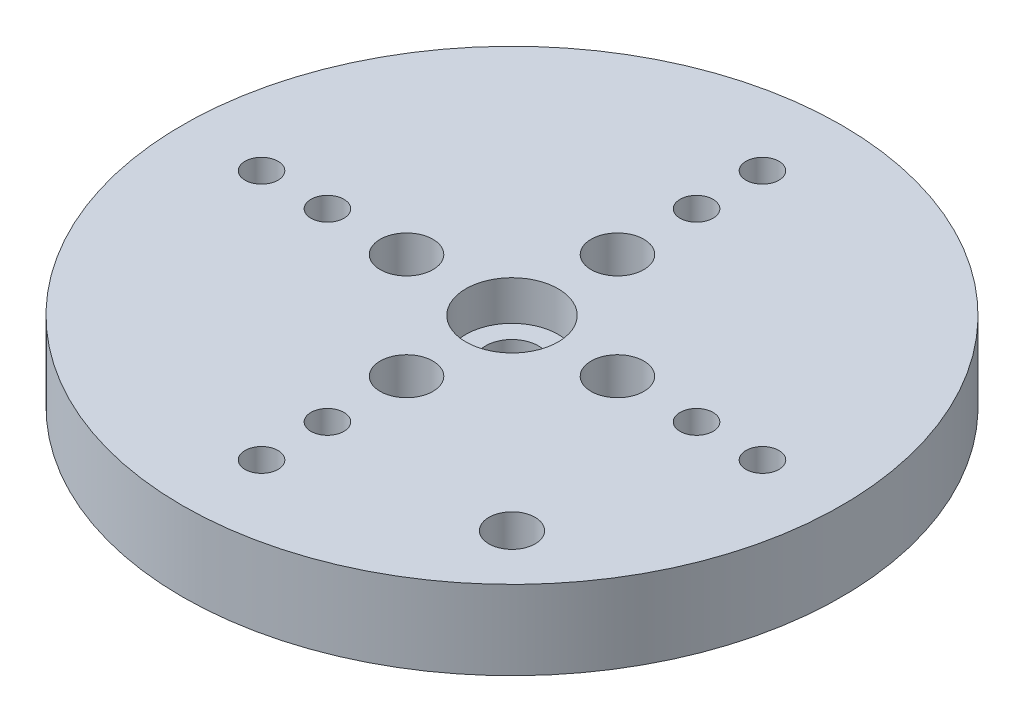
from build123d import *

# Parameters (mm, degrees)
SKETCH1_R           = 25
BOSS_EXTRUDE1_DEPTH = 6
CUT_EXTRUDE1_REACH  = 37.861
SKETCH2_R           = 2
SKETCH2_R_2         = 1.25
CIRPATTERN1_COUNT   = 4
CUT_EXTRUDE2_REACH  = 37.861
SKETCH3_R           = 2
SKETCH3_R_2         = 1.75
SKETCH4_R           = 3.5
CUT_EXTRUDE3_DEPTH  = 3


with BuildPart() as part:
    # Sketch1 → Boss-Extrude1 (new body)
    with BuildSketch(Plane(origin=(0, 0, 0), x_dir=(1, 0, 0), z_dir=(0, 1, 0))):
        Circle(SKETCH1_R)
    extrude(amount=BOSS_EXTRUDE1_DEPTH)

    # Sketch2 → Cut-Extrude1 (cut, up to next)
    with BuildSketch(Plane(origin=(0, 6, 0), x_dir=(1, 0, 0), z_dir=(0, 1, 0)), mode=Mode.PRIVATE) as cut_extrude1_sk1:
        with Locations((0, -8)):
            Circle(SKETCH2_R)
    cut_extrude1_tool1 = extrude(cut_extrude1_sk1.sketch, amount=-CUT_EXTRUDE1_REACH, mode=Mode.PRIVATE) & part.part
    # Sketch2 → Cut-Extrude1 (cut, up to next)
    with BuildSketch(Plane(origin=(0, 6, 0), x_dir=(1, 0, 0), z_dir=(0, 1, 0)), mode=Mode.PRIVATE) as cut_extrude1_sk2:
        with Locations((0, -14)):
            Circle(SKETCH2_R_2)
    cut_extrude1_tool2 = extrude(cut_extrude1_sk2.sketch, amount=-CUT_EXTRUDE1_REACH, mode=Mode.PRIVATE) & part.part
    # Sketch2 → Cut-Extrude1 (cut, up to next)
    with BuildSketch(Plane(origin=(0, 6, 0), x_dir=(1, 0, 0), z_dir=(0, 1, 0)), mode=Mode.PRIVATE) as cut_extrude1_sk3:
        with Locations((0, -19)):
            Circle(SKETCH2_R_2)
    cut_extrude1_tool3 = extrude(cut_extrude1_sk3.sketch, amount=-CUT_EXTRUDE1_REACH, mode=Mode.PRIVATE) & part.part
    cut_extrude1_1 = cut_extrude1_tool1.solids().sort_by_distance((0, 6, 8))[0]
    add(cut_extrude1_1, mode=Mode.SUBTRACT)
    cut_extrude1_2 = cut_extrude1_tool2.solids().sort_by_distance((0, 6, 14))[0]
    add(cut_extrude1_2, mode=Mode.SUBTRACT)
    cut_extrude1_3 = cut_extrude1_tool3.solids().sort_by_distance((0, 6, 19))[0]
    add(cut_extrude1_3, mode=Mode.SUBTRACT)
    cut_extrude1 = cut_extrude1_1 + cut_extrude1_2 + cut_extrude1_3  # Cut-Extrude1 as one shape, for the pattern or mirror that repeats it

    # CirPattern1: Cut-Extrude1 ×4 about axis
    cirpattern1_axis = Axis((0, 6, 0), (0, -1, 0))
    for i in range(1, CIRPATTERN1_COUNT):
        add(cut_extrude1.rotate(cirpattern1_axis, i * 360 / CIRPATTERN1_COUNT), mode=Mode.SUBTRACT)

    # Sketch3 → Cut-Extrude2 (cut, up to next)
    with BuildSketch(Plane(origin=(0, 6, 0), x_dir=(1, 0, 0), z_dir=(0, 1, 0)), mode=Mode.PRIVATE) as cut_extrude2_sk1:
        Circle(SKETCH3_R)
    cut_extrude2_tool1 = extrude(cut_extrude2_sk1.sketch, amount=-CUT_EXTRUDE2_REACH, mode=Mode.PRIVATE) & part.part
    # Sketch3 → Cut-Extrude2 (cut, up to next)
    with BuildSketch(Plane(origin=(0, 6, 0), x_dir=(1, 0, 0), z_dir=(0, 1, 0)), mode=Mode.PRIVATE) as cut_extrude2_sk2:
        with Locations((14.142135624, -14.142135624)):
            Circle(SKETCH3_R_2)
    cut_extrude2_tool2 = extrude(cut_extrude2_sk2.sketch, amount=-CUT_EXTRUDE2_REACH, mode=Mode.PRIVATE) & part.part
    add(cut_extrude2_tool1.solids().sort_by_distance((0, 6, 0))[0], mode=Mode.SUBTRACT)
    add(cut_extrude2_tool2.solids().sort_by_distance((14.142136, 6, 14.142136))[0], mode=Mode.SUBTRACT)

    # Sketch4 → Cut-Extrude3 (cut)
    with BuildSketch(Plane(origin=(0, 6, 0), x_dir=(1, 0, 0), z_dir=(0, 1, 0))):
        Circle(SKETCH4_R)
    extrude(amount=-CUT_EXTRUDE3_DEPTH, mode=Mode.SUBTRACT)


solid = part.part
